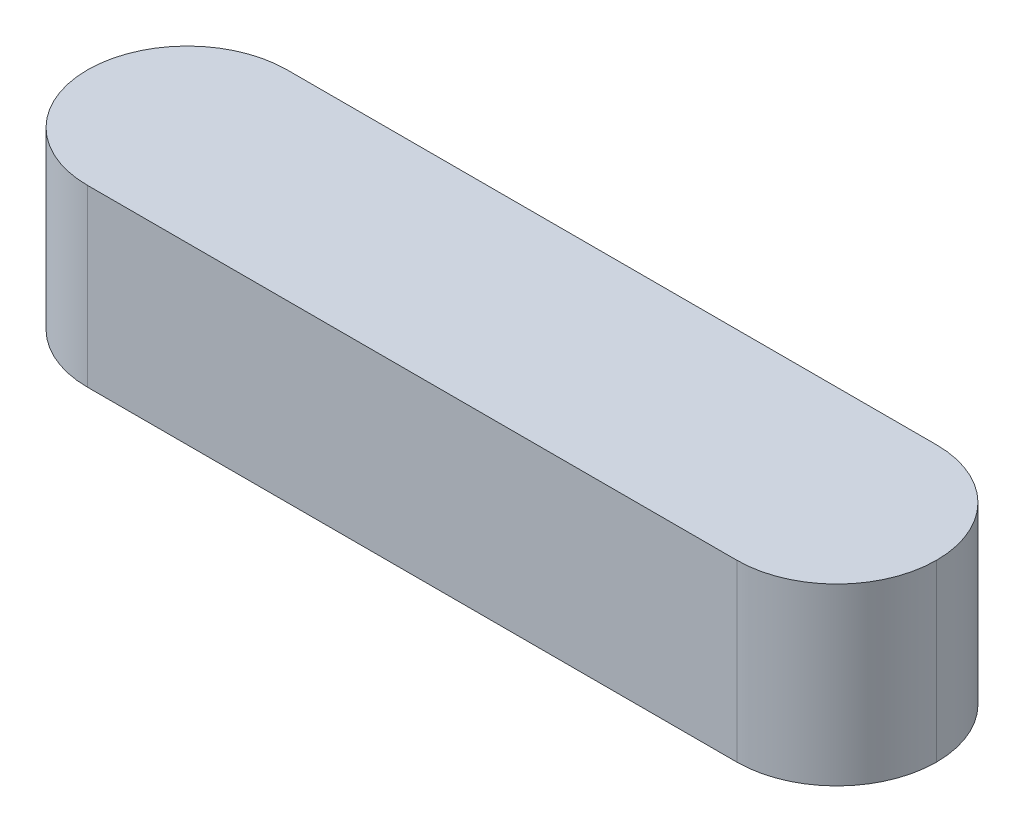
from build123d import *

# Parameters (mm, degrees)
SKETCH1_W           = 34
SKETCH1_H           = 8
BOSS_EXTRUDE1_DEPTH = 7
FILLET1_R           = 4


with BuildPart() as part:
    # Sketch1 → Boss-Extrude1 (new body)
    with BuildSketch(Plane(origin=(0, 0, 0), x_dir=(1, 0, 0), z_dir=(0, 1, 0))):
        with Locations((7.090206491, 4)):
            Rectangle(SKETCH1_W, SKETCH1_H)
    extrude(amount=BOSS_EXTRUDE1_DEPTH)

    # Fillet1
    fillet1_edges = [part.edges().sort_by_distance(p)[0] for p in [
        (24.090206491, 3.5, -8),
        (24.090206491, 3.5, 0),
        (-9.909793509, 3.5, -8),
        (-9.909793509, 3.5, 0),
    ]]
    fillet(fillet1_edges, radius=FILLET1_R - 0.0001)  # a hair under: the kernel refuses the full size


solid = part.part
